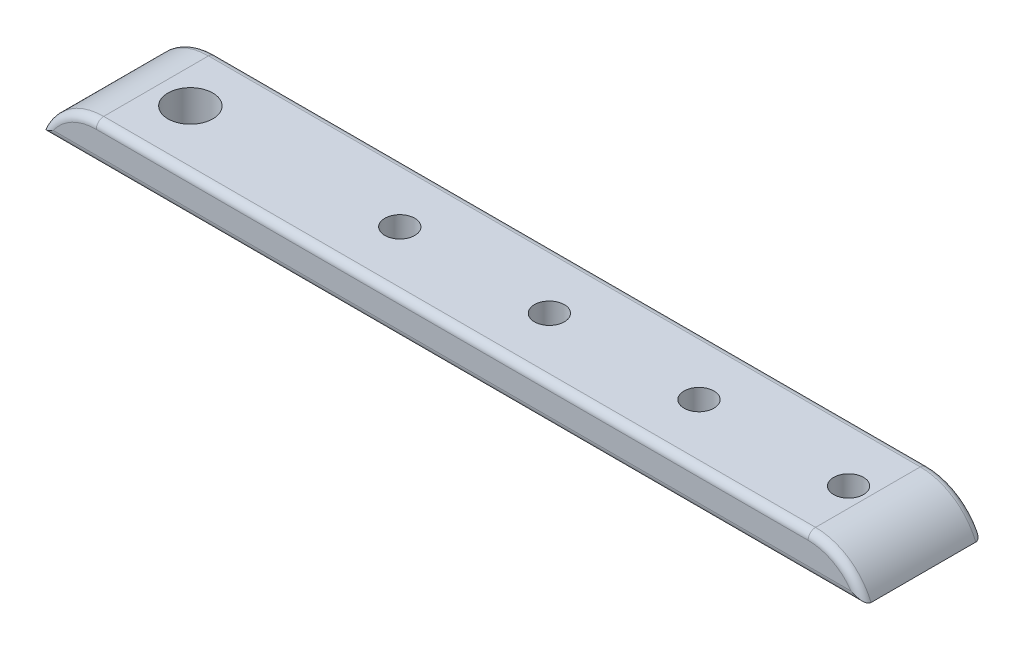
from build123d import *

# Parameters (mm, degrees)
SKETCH2_W           = 110
SKETCH2_H           = 16
BOSS_EXTRUDE1_DEPTH = 5
SKETCH3_R           = 3
CUT_EXTRUDE1_DEPTH  = 56.803225713
SKETCH5_R           = 2
CUT_EXTRUDE2_DEPTH  = 56.803225713
FILLET1_R           = 8
FILLET2_R           = 1


with BuildPart() as part:
    # Sketch2 → Boss-Extrude1 (new body)
    with BuildSketch(Plane(origin=(0, 0, 0), x_dir=(1, 0, 0), z_dir=(0, 1, 0))):
        Rectangle(SKETCH2_W, SKETCH2_H)
    extrude(amount=BOSS_EXTRUDE1_DEPTH)

    # Sketch3 → Cut-Extrude1 (cut, through all)
    with BuildSketch(Plane(origin=(0, 5, 0), x_dir=(1, 0, 0), z_dir=(0, 1, 0))):
        with Locations(Location((-43, 0, 0), (0, 0, 270))):
            Circle(SKETCH3_R)
    extrude(amount=-CUT_EXTRUDE1_DEPTH, mode=Mode.SUBTRACT)

    # Sketch5 → Cut-Extrude2 (cut, through all)
    with BuildSketch(Plane(origin=(0, 5, 0), x_dir=(1, 0, 0), z_dir=(0, 1, 0))):
        with Locations(Location((-15, 0, 0), (0, 0, 270))):
            Circle(SKETCH5_R)
        with Locations(Location((5, 0, 0), (0, 0, 270))):
            Circle(SKETCH5_R)
        with Locations(Location((25, 0, 0), (0, 0, 270))):
            Circle(SKETCH5_R)
        with Locations(Location((45, 0, 0), (0, 0, 270))):
            Circle(SKETCH5_R)
    extrude(amount=-CUT_EXTRUDE2_DEPTH, mode=Mode.SUBTRACT)

    # Fillet1
    # the kernel refuses this fillet: 8 mm, written as the material it takes off along each edge
    with BuildSketch(Plane(origin=(55, 5, -26.540496218), x_dir=(0, -1, 0), z_dir=(0, 0, 1)), Plane(origin=(-55, 5, 26.540496218), x_dir=(0, -1, 0), z_dir=(0, 0, -1))) as fillet1_piece_1:
        with BuildLine():
            CenterArc((8, -7.416198487), FILLET1_R, 112.024312837, 67.975687163)
            Line((0, -7.416198487), (-0.16, -7.416198487))
            Line((-0.16, -7.416198487), (-0.16, 0))
            Line((-0.16, 0), (0, 0.16))
            ThreePointArc((0, 0.16), (2.5, 0.16), (4.94, 0.14832397))
            Line((4.94, 0.14832397), (5, 0))
        make_face()
    extrude(amount=53.080992435, mode=Mode.SUBTRACT)

    # Fillet2
    fillet2_edges = [part.edges().sort_by_distance(p)[0] for p in [
        (0, 5, -8),
        (0, 5, 8),
        (-52.055937468, 3.633249581, -8),
        (52.055937468, 3.633249581, -8),
        (-52.055937468, 3.633249581, 8),
        (52.055937468, 3.633249581, 8),
        (0, 0, 8),
        (0, 0, -8),
    ]]
    fillet(fillet2_edges, radius=FILLET2_R)


solid = part.part
